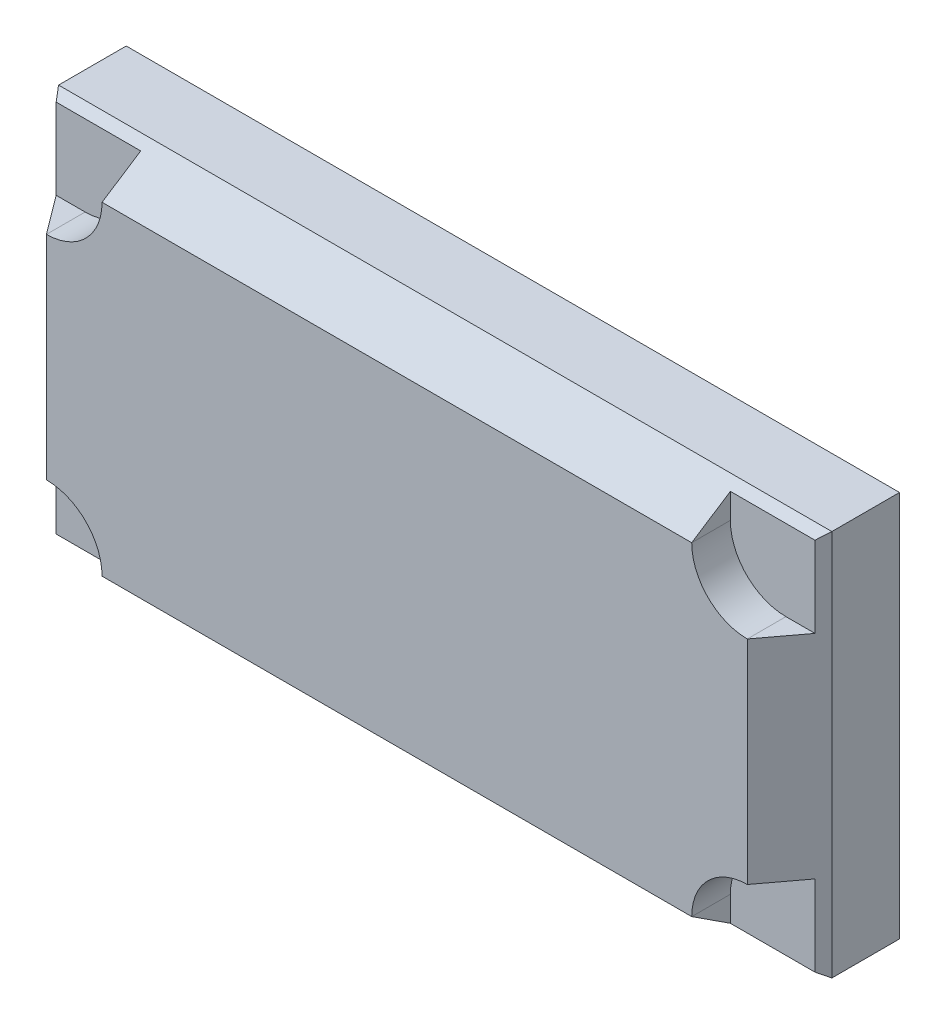
from build123d import *

# Parameters (mm, degrees)
SKETCH1_W           = 39.99992
SKETCH1_H           = 19.99996
BOSS_EXTRUDE1_DEPTH = 3.499993
CUT_EXTRUDE1_START  = -2.00000108
CUT_EXTRUDE1_DEPTH  = 2.00000108


# Read off the part's stored shape, not the designer's step: Cut-Extrude1
with BuildPart() as part:
    # Sketch1 → Boss-Extrude1 (new body)
    with BuildSketch(Plane.XY):
        Rectangle(SKETCH1_W, SKETCH1_H)
    extrude(amount=BOSS_EXTRUDE1_DEPTH)

    # Sketch3 → section 0 of loft1
    with BuildSketch(Plane.XY.offset(5.99999308), mode=Mode.PRIVATE) as loft1_s0:
        with BuildLine():
            Line((-18.12500058, -8.375000014), (18.12500058, -8.375000014))
            Line((18.12500058, -8.375000014), (18.12500058, 8.375000014))
            Line((18.12500058, 8.375000014), (-18.12500058, 8.375000014))
            Line((-18.12500058, 8.375000014), (-18.12500058, -8.375000014))
        make_face()
    # loft up to a face of the part (loft1)
    loft([loft1_s0.sketch, part.faces().sort_by_distance((0, 0, 3.499993))[0]])

    # Cut-Extrude1 outline → Cut-Extrude1 (cut)
    with BuildSketch(Plane.XY.offset(5.99999308).offset(CUT_EXTRUDE1_START)):
        with BuildLine():
            ThreePointArc((-15.250002266, -8.375000014), (-16.092069776, -6.34206921), (-18.12500058, -5.5000017))
            Line((-18.12500058, -5.5000017), (-19.99996, -5.5000017))
            Line((-19.99996, -5.5000017), (-19.99996, -9.99998))
            Line((-19.99996, -9.99998), (-15.250002266, -9.99998))
            Line((-15.250002266, -9.99998), (-15.250002266, -8.375000014))
        make_face()
        with BuildLine():
            ThreePointArc((18.12500058, -5.5000017), (16.092069776, -6.34206921), (15.250002266, -8.375000014))
            Line((15.250002266, -8.375000014), (15.250002266, -9.99998))
            Line((15.250002266, -9.99998), (19.99996, -9.99998))
            Line((19.99996, -9.99998), (19.99996, -5.5000017))
            Line((19.99996, -5.5000017), (18.12500058, -5.5000017))
        make_face()
        with BuildLine():
            ThreePointArc((-18.12500058, 5.5000017), (-16.092069776, 6.34206921), (-15.250002266, 8.375000014))
            Line((-15.250002266, 8.375000014), (-15.250002266, 9.99998))
            Line((-15.250002266, 9.99998), (-19.99996, 9.99998))
            Line((-19.99996, 9.99998), (-19.99996, 5.5000017))
            Line((-19.99996, 5.5000017), (-18.12500058, 5.5000017))
        make_face()
        with BuildLine():
            ThreePointArc((15.250002266, 8.375000014), (16.092069776, 6.34206921), (18.12500058, 5.5000017))
            Line((18.12500058, 5.5000017), (19.99996, 5.5000017))
            Line((19.99996, 5.5000017), (19.99996, 9.99998))
            Line((19.99996, 9.99998), (15.250002266, 9.99998))
            Line((15.250002266, 9.99998), (15.250002266, 8.375000014))
        make_face()
    extrude(amount=CUT_EXTRUDE1_DEPTH, mode=Mode.SUBTRACT)


solid = part.part
